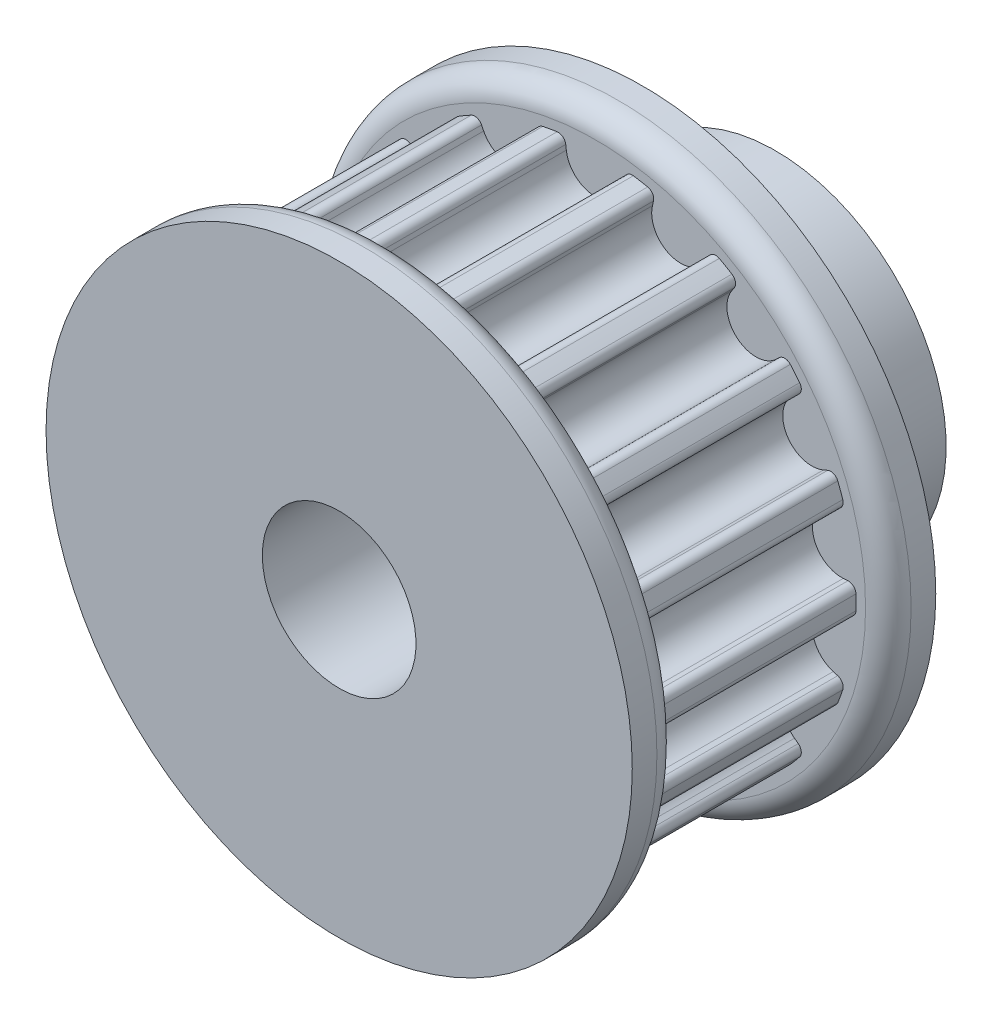
from build123d import *

# Parameters (mm, degrees)
SKETCH_3_R                       = 13.752444878
EXTRUDE_2_DEPTH                  = 5.5
CUT_EXTRUDE_2_DEPTH              = 21.211617458
FILLET_1_R                       = 0.4
PATTERN_CIRCULAR_1_COUNT         = 18
FILLET_1_OF_PATTERN_CIRCULAR_1_R = 0.4
SKETCH_12_R                      = 15.452444878
EXTRUDE_4_DEPTH                  = 2.5
EXTRUDE_START                    = 2.5
SKETCH_13_R                      = 15.452444878
EXTRUDE_5_DEPTH                  = 2.5
FILLET_2_R                       = 1.2
SKETCH_5_R                       = 9
EXTRUDE_3_DEPTH                  = 7
SKETCH_4_R                       = 4.05
CUT_EXTRUDE_3_DEPTH              = 32.726268382
SKETCH_8_W                       = 1.2
SKETCH_8_H                       = 15.452444878


with BuildPart() as part:
    # 스케치3 → 보스-돌출2 (new, symmetric)
    with BuildSketch(Plane.XY):
        Circle(SKETCH_3_R)
    extrude(amount=EXTRUDE_2_DEPTH, both=True)

    # 스케치3<3> → 컷-돌출2 (cut, symmetric)
    with BuildSketch(Plane.XY):
        with BuildLine():
            Line((-1.600765204, 13.658963756), (-1.524565963, 13.008773041))
            ThreePointArc((-1.524565963, 13.008773041), (0, 11.652444878), (1.524565963, 13.008773041))
            Line((1.524565963, 13.008773041), (1.600765204, 13.658963756))
            ThreePointArc((1.600765204, 13.658963756), (0, 13.752444878), (-1.600765204, 13.658963756))
        make_face()
    cut_extrude_2 = extrude(amount=CUT_EXTRUDE_2_DEPTH, both=True, mode=Mode.SUBTRACT)

    # 필렛1
    fillet_1_edges = [part.edges().sort_by_distance(p)[0] for p in [
        (1.600765204, 13.658963756, 0),
        (-1.600765204, 13.658963756, 0),
    ]]
    fillet(fillet_1_edges, radius=FILLET_1_R)

    # 원형 패턴1: 컷-돌출2 ×18 about axis
    pattern_circular_1_axis = Axis((0, 0, 5.5), (0, 0, -1))
    for i in range(1, PATTERN_CIRCULAR_1_COUNT):
        add(cut_extrude_2.rotate(pattern_circular_1_axis, i * 360 / PATTERN_CIRCULAR_1_COUNT), mode=Mode.SUBTRACT)

    # 필렛1 of 원형 패턴1
    fillet_1_of_pattern_circular_1_edges = [part.edges().sort_by_distance(p)[0] for p in [
        (6.175867991, 12.287733505, 0),
        (3.167413492, 13.382721394, 0),
        (10.006069953, 9.434421245, 0),
        (7.553555375, 11.492325323, 0),
        (12.629392204, 5.443178546, 0),
        (11.028627, 8.21578521, 0),
        (13.729423366, 0.795408182, 0),
        (13.173483445, 3.948300149, 0),
        (13.173483445, -3.948300149, 0),
        (13.729423366, -0.795408182, 0),
        (11.028627, -8.21578521, 0),
        (12.629392204, -5.443178546, 0),
        (7.553555375, -11.492325323, 0),
        (10.006069953, -9.434421245, 0),
        (3.167413492, -13.382721394, 0),
        (6.175867991, -12.287733505, 0),
        (-1.600765204, -13.658963756, 0),
        (1.600765204, -13.658963756, 0),
        (-6.175867991, -12.287733505, 0),
        (-3.167413492, -13.382721394, 0),
        (-10.006069953, -9.434421245, 0),
        (-7.553555375, -11.492325323, 0),
        (-12.629392204, -5.443178546, 0),
        (-11.028627, -8.21578521, 0),
        (-13.729423366, -0.795408182, 0),
        (-13.173483445, -3.948300149, 0),
        (-13.173483445, 3.948300149, 0),
        (-13.729423366, 0.795408182, 0),
        (-11.028627, 8.21578521, 0),
        (-12.629392204, 5.443178546, 0),
        (-7.553555375, 11.492325323, 0),
        (-10.006069953, 9.434421245, 0),
        (-3.167413492, 13.382721394, 0),
        (-6.175867991, 12.287733505, 0),
    ]]
    fillet(fillet_1_of_pattern_circular_1_edges, radius=FILLET_1_OF_PATTERN_CIRCULAR_1_R)

    # 스케치12 → 보스-돌출4 (add)
    with BuildSketch(Plane.XY.offset(5.5)):
        Circle(SKETCH_12_R)
    extrude(amount=EXTRUDE_4_DEPTH)

    # 스케치13 → 보스-돌출5 (add)
    with BuildSketch(Plane(origin=(0, 0, -5.5), x_dir=(-1, 0, 0), z_dir=(0, 0, -1)).offset(EXTRUDE_START)):
        Circle(SKETCH_13_R)
    extrude(amount=-EXTRUDE_5_DEPTH)

    # 필렛2
    fillet_2_edges = [part.edges().sort_by_distance(p)[0] for p in [
        (-15.452444878, 0, 5.5),
        (15.452444878, 0, -5.5),
    ]]
    fillet(fillet_2_edges, radius=FILLET_2_R)

    # 스케치5 → 보스-돌출3 (add)
    with BuildSketch(Plane(origin=(0, 0, -8), x_dir=(-1, 0, 0), z_dir=(0, 0, -1))):
        Circle(SKETCH_5_R)
    extrude(amount=EXTRUDE_3_DEPTH)

    # 스케치4 → 컷-돌출3 (cut, through all)
    with BuildSketch(Plane(origin=(0, 0, 8), x_dir=(-1, 0, 0), z_dir=(0, 0, -1))):
        Circle(SKETCH_4_R)
    extrude(amount=CUT_EXTRUDE_3_DEPTH, mode=Mode.SUBTRACT)

    # 스케치8 → M3x0.5 탭을 위한 탭 드릴1 (revolve, cut)
    with BuildSketch(Plane(origin=(0, 0, -11.5), x_dir=(0, 0, -1), z_dir=(1, 0, 0))):
        with Locations((0.6, 7.726222439)):
            Rectangle(SKETCH_8_W, SKETCH_8_H)
    revolve(axis=Axis((0, -6.35, -11.5), (0, 1, 0)), mode=Mode.SUBTRACT)


solid = part.part
